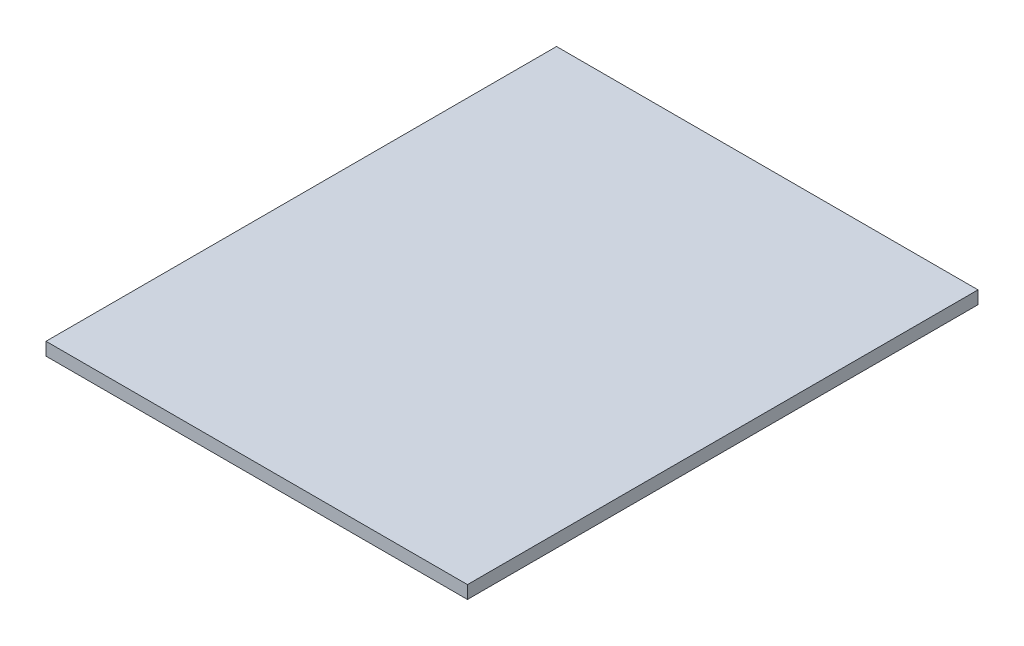
from build123d import *

# Parameters (mm, degrees)
SKETCH_1_W      = 32.657175128
SKETCH_1_H      = 39.558949254
EXTRUDE_1_DEPTH = 1


with BuildPart() as part:
    # 草图1 → 凸台-拉伸1 (new body)
    with BuildSketch(Plane(origin=(0, 0, 0), x_dir=(1, 0, 0), z_dir=(0, 1, 0))):
        Rectangle(SKETCH_1_W, SKETCH_1_H)
    extrude(amount=EXTRUDE_1_DEPTH)


solid = part.part
